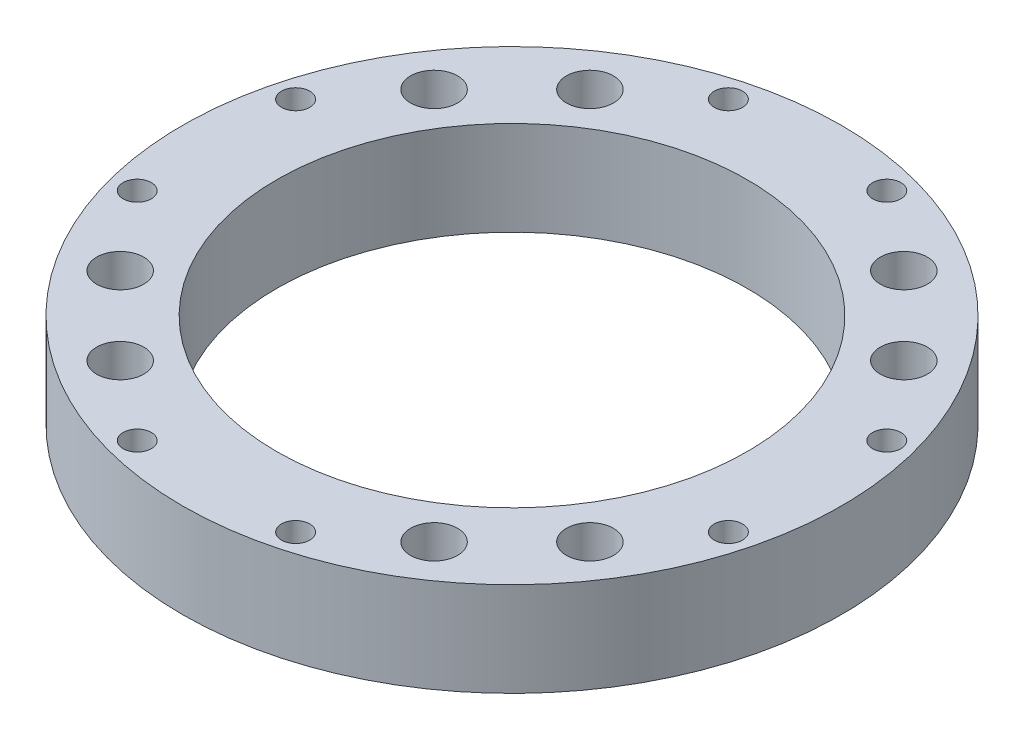
from build123d import *

# Parameters (mm, degrees)
SKETCH1_R           = 35
SKETCH1_R_2         = 25
SKETCH1_R_3         = 1.5
SKETCH1_R_4         = 2.5
BOSS_EXTRUDE1_DEPTH = 10


with BuildPart() as part:
    # Sketch1 → Boss-Extrude1 (new body)
    with BuildSketch(Plane(origin=(0, 0, 0), x_dir=(1, 0, 0), z_dir=(0, 1, 0))):
        Circle(SKETCH1_R)
        Circle(SKETCH1_R_2, mode=Mode.SUBTRACT)
        with Locations((-8.411618966, 31.392589354)):
            Circle(SKETCH1_R_3, mode=Mode.SUBTRACT)
        with Locations((8.411618966, 31.392589354)):
            Circle(SKETCH1_R_3, mode=Mode.SUBTRACT)
        with Locations((31.392589354, 8.411618966)):
            Circle(SKETCH1_R_3, mode=Mode.SUBTRACT)
        with Locations((31.392589354, -8.411618966)):
            Circle(SKETCH1_R_3, mode=Mode.SUBTRACT)
        with Locations((8.411618966, -31.392589354)):
            Circle(SKETCH1_R_3, mode=Mode.SUBTRACT)
        with Locations((-8.411618966, -31.392589354)):
            Circle(SKETCH1_R_3, mode=Mode.SUBTRACT)
        with Locations((-31.392589354, -8.411618966)):
            Circle(SKETCH1_R_3, mode=Mode.SUBTRACT)
        with Locations((-31.392589354, 8.411618966)):
            Circle(SKETCH1_R_3, mode=Mode.SUBTRACT)
        with Locations((-24.944088369, 16.667106991)):
            Circle(SKETCH1_R_4, mode=Mode.SUBTRACT)
        with Locations((-16.667106991, 24.944088369)):
            Circle(SKETCH1_R_4, mode=Mode.SUBTRACT)
        with Locations((16.667106991, 24.944088369)):
            Circle(SKETCH1_R_4, mode=Mode.SUBTRACT)
        with Locations((24.944088369, 16.667106991)):
            Circle(SKETCH1_R_4, mode=Mode.SUBTRACT)
        with Locations((24.944088369, -16.667106991)):
            Circle(SKETCH1_R_4, mode=Mode.SUBTRACT)
        with Locations((16.667106991, -24.944088369)):
            Circle(SKETCH1_R_4, mode=Mode.SUBTRACT)
        with Locations((-16.667106991, -24.944088369)):
            Circle(SKETCH1_R_4, mode=Mode.SUBTRACT)
        with Locations((-24.944088369, -16.667106991)):
            Circle(SKETCH1_R_4, mode=Mode.SUBTRACT)
    extrude(amount=BOSS_EXTRUDE1_DEPTH)


solid = part.part
